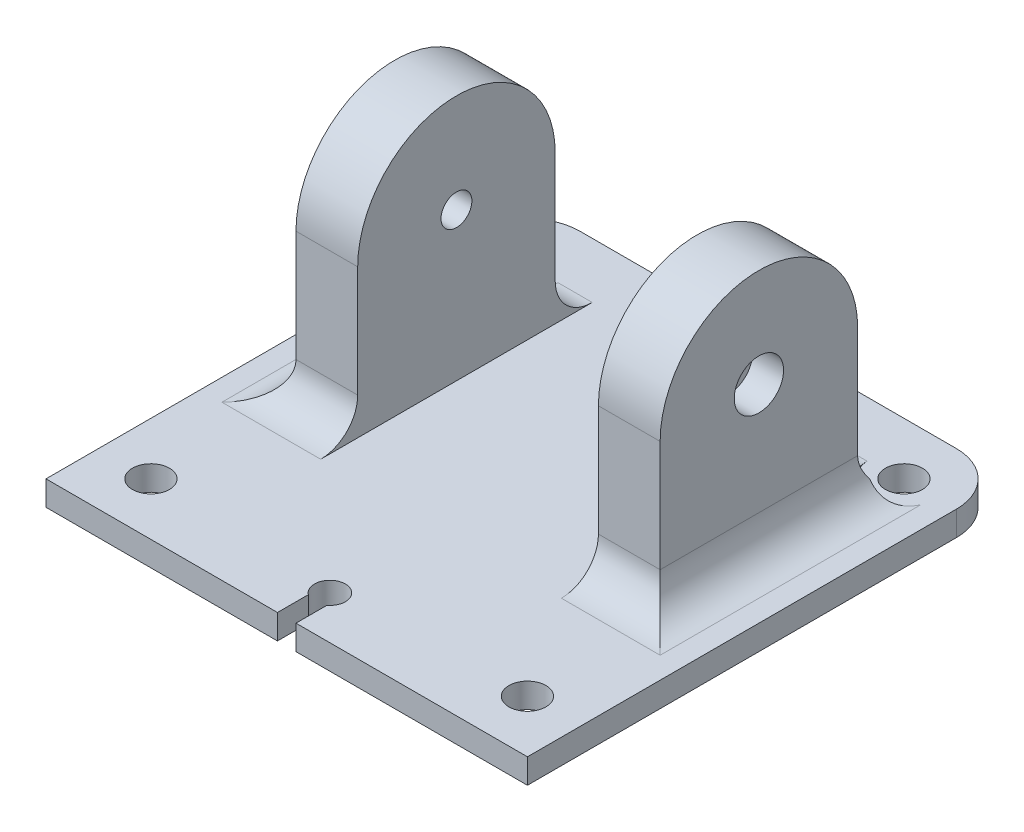
from build123d import *

# Parameters (mm, degrees)
SKETCH1_W           = 39
SKETCH1_H           = 39
SKETCH1_R           = 1.5
BOSS_EXTRUDE1_DEPTH = 2
SKETCH2_W           = 5
SKETCH2_H           = 16
BOSS_EXTRUDE2_DEPTH = 20
CUT_EXTRUDE1_REACH  = 47.137
SKETCH3_R           = 1.25
CUT_EXTRUDE2_REACH  = 36.066
SKETCH4_R           = 1.25
SKETCH4_W           = 1.5
SKETCH4_H           = 3.5
FILLET1_R           = 3
SKETCH6_R           = 2
CUT_EXTRUDE3_DEPTH  = 2.5
CUT_EXTRUDE4_START  = -2.5
SKETCH7_R           = 2
CUT_EXTRUDE4_DEPTH  = 2.5
SKETCH8_R           = 2.75
CUT_EXTRUDE5_DEPTH  = 20


with BuildPart() as part:
    # Sketch1 → Boss-Extrude1 (new body)
    with BuildSketch(Plane(origin=(0, 0, 0), x_dir=(1, 0, 0), z_dir=(0, 1, 0))):
        Rectangle(SKETCH1_W, SKETCH1_H)
        with Locations(Location((-15.25, 15.25, 0), (0, 0, 270))):
            Circle(SKETCH1_R, mode=Mode.SUBTRACT)
        with Locations(Location((15.25, 15.25, 0), (0, 0, 90))):
            Circle(SKETCH1_R, mode=Mode.SUBTRACT)
        with Locations(Location((15.25, -15.25, 0), (0, 0, 270))):
            Circle(SKETCH1_R, mode=Mode.SUBTRACT)
        with Locations(Location((-15.25, -15.25, 0), (0, 0, 90))):
            Circle(SKETCH1_R, mode=Mode.SUBTRACT)
    extrude(amount=BOSS_EXTRUDE1_DEPTH)

    # Sketch2 → Boss-Extrude2 (add)
    with BuildSketch(Plane(origin=(0, 2, 0), x_dir=(1, 0, 0), z_dir=(0, 1, 0))):
        with Locations((-12.25, 4)):
            Rectangle(SKETCH2_W, SKETCH2_H)
        with Locations((12.25, 4)):
            Rectangle(SKETCH2_W, SKETCH2_H)
    extrude(amount=BOSS_EXTRUDE2_DEPTH)

    # Cut-Extrude1: up to this face of the body (flat: up to its plane)
    cut_extrude1_end = Plane(part.part.faces().sort_by_distance((14.75, 12, -4))[0])
    # Sketch3 → Cut-Extrude1 (cut, up to the picked face)
    with BuildSketch(Plane.ZY.offset(14.75), mode=Mode.PRIVATE) as cut_extrude1_sk1:
        with BuildLine():
            Line((-12, 22), (-12, 14))
            ThreePointArc((-12, 14), (-9.656854249, 19.656854249), (-4, 22))
            Line((-4, 22), (-12, 22))
        make_face()
    cut_extrude1_tool1 = split(extrude(cut_extrude1_sk1.sketch, amount=-CUT_EXTRUDE1_REACH, mode=Mode.PRIVATE), bisect_by=cut_extrude1_end, keep=Keep.BOTH, mode=Mode.PRIVATE)
    # Sketch3 → Cut-Extrude1 (cut, up to the picked face)
    with BuildSketch(Plane.ZY.offset(14.75), mode=Mode.PRIVATE) as cut_extrude1_sk2:
        with BuildLine():
            ThreePointArc((-4, 22), (1.656854249, 19.656854249), (4, 14))
            Line((4, 14), (4, 22))
            Line((4, 22), (-4, 22))
        make_face()
    cut_extrude1_tool2 = split(extrude(cut_extrude1_sk2.sketch, amount=-CUT_EXTRUDE1_REACH, mode=Mode.PRIVATE), bisect_by=cut_extrude1_end, keep=Keep.BOTH, mode=Mode.PRIVATE)
    # Sketch3 → Cut-Extrude1 (cut, up to the picked face)
    with BuildSketch(Plane.ZY.offset(14.75), mode=Mode.PRIVATE) as cut_extrude1_sk3:
        with Locations(Location((-4, 14, 0), (0, 0, 180))):
            Circle(SKETCH3_R)
    cut_extrude1_tool3 = split(extrude(cut_extrude1_sk3.sketch, amount=-CUT_EXTRUDE1_REACH, mode=Mode.PRIVATE), bisect_by=cut_extrude1_end, keep=Keep.BOTH, mode=Mode.PRIVATE)
    add(cut_extrude1_tool1.solids().sort_by(Axis((-14.75, 20.213056, -10.213056), (1, 0, 0)))[0], mode=Mode.SUBTRACT)
    add(cut_extrude1_tool2.solids().sort_by(Axis((-14.75, 20.213056, 2.213056), (1, 0, 0)))[0], mode=Mode.SUBTRACT)
    add(cut_extrude1_tool3.solids().sort_by(Axis((-14.75, 14, -4), (1, 0, 0)))[0], mode=Mode.SUBTRACT)

    # Sketch4 → Cut-Extrude2 (cut, up to next)
    with BuildSketch(Plane(origin=(0, 2, 0), x_dir=(1, 0, 0), z_dir=(0, 1, 0)), mode=Mode.PRIVATE) as cut_extrude2_sk1:
        with BuildLine():
            Line((-19.5, 19.5), (-19.5, 15.25))
            ThreePointArc((-19.5, 15.25), (-18.25520382, 18.25520382), (-15.249999999, 19.5))
            Line((-15.249999999, 19.5), (-19.5, 19.5))
        make_face()
    cut_extrude2_tool1 = extrude(cut_extrude2_sk1.sketch, amount=-CUT_EXTRUDE2_REACH, mode=Mode.PRIVATE) & part.part
    # Sketch4 → Cut-Extrude2 (cut, up to next)
    with BuildSketch(Plane(origin=(0, 2, 0), x_dir=(1, 0, 0), z_dir=(0, 1, 0)), mode=Mode.PRIVATE) as cut_extrude2_sk2:
        with BuildLine():
            ThreePointArc((15.25, 19.5), (18.25520382, 18.25520382), (19.5, 15.25))
            Line((19.5, 15.25), (19.5, 19.5))
            Line((19.5, 19.5), (15.25, 19.5))
        make_face()
    cut_extrude2_tool2 = extrude(cut_extrude2_sk2.sketch, amount=-CUT_EXTRUDE2_REACH, mode=Mode.PRIVATE) & part.part
    # Sketch4 → Cut-Extrude2 (cut, up to next)
    with BuildSketch(Plane(origin=(0, 2, 0), x_dir=(1, 0, 0), z_dir=(0, 1, 0)), mode=Mode.PRIVATE) as cut_extrude2_sk3:
        with Locations((0, -16)):
            Circle(SKETCH4_R)
    cut_extrude2_tool3 = extrude(cut_extrude2_sk3.sketch, amount=-CUT_EXTRUDE2_REACH, mode=Mode.PRIVATE) & part.part
    # Sketch4 → Cut-Extrude2 (cut, up to next)
    with BuildSketch(Plane(origin=(0, 2, 0), x_dir=(1, 0, 0), z_dir=(0, 1, 0)), mode=Mode.PRIVATE) as cut_extrude2_sk4:
        with Locations((0, -17.75)):
            Rectangle(SKETCH4_W, SKETCH4_H)
    cut_extrude2_tool4 = extrude(cut_extrude2_sk4.sketch, amount=-CUT_EXTRUDE2_REACH, mode=Mode.PRIVATE) & part.part
    add(cut_extrude2_tool1.solids().sort_by_distance((-18.550686, 2, -18.550686))[0], mode=Mode.SUBTRACT)
    add(cut_extrude2_tool2.solids().sort_by_distance((18.550686, 2, -18.550686))[0], mode=Mode.SUBTRACT)
    add(cut_extrude2_tool3.solids().sort_by_distance((0, 2, 16))[0], mode=Mode.SUBTRACT)
    add(cut_extrude2_tool4.solids().sort_by_distance((0, 2, 17.75))[0], mode=Mode.SUBTRACT)

    # Fillet1
    # the kernel refuses this fillet: 3 mm, written as the material it adds along each edge
    with BuildSketch(Plane(origin=(-9.75, 2, -12), x_dir=(0, 0, -1), z_dir=(-1, 0, 0))) as fillet1_piece_1_section:
        with BuildLine():
            CenterArc((FILLET1_R, -FILLET1_R), FILLET1_R, 90, 90)
            Line((0, -FILLET1_R), (0, 0))
            Line((0, 0), (FILLET1_R, 0))
        make_face()
    fillet1_piece_1 = extrude(amount=5, mode=Mode.PRIVATE)
    fillet1_piece_1 = fillet1_piece_1 - Plane(origin=(-15.25, 2.68425546, -15.25), x_dir=(0, 0, 1), z_dir=(0, -1, 0)) * Cylinder(1.5, 23, mode=Mode.PRIVATE)
    add(fillet1_piece_1)
    with BuildSketch(Plane(origin=(-14.75, 2, -12), x_dir=(-1, 0, 0), z_dir=(0, 0, 1))) as fillet1_piece_2:
        with BuildLine():
            CenterArc((FILLET1_R, -FILLET1_R), FILLET1_R, 90, 90)
            Line((0, -FILLET1_R), (0, 0))
            Line((0, 0), (FILLET1_R, 0))
        make_face()
    extrude(amount=16)
    with BuildSketch(Plane(origin=(-14.75, 2, 4), x_dir=(0, 0, 1), z_dir=(1, 0, 0))) as fillet1_piece_3:
        with BuildLine():
            CenterArc((FILLET1_R, -FILLET1_R), FILLET1_R, 90, 90)
            Line((0, -FILLET1_R), (0, 0))
            Line((0, 0), (FILLET1_R, 0))
        make_face()
    extrude(amount=5)
    with BuildSketch(Plane(origin=(14.75, 2, 4), x_dir=(0, 0, 1), z_dir=(-1, 0, 0))) as fillet1_piece_4:
        with BuildLine():
            CenterArc((FILLET1_R, FILLET1_R), FILLET1_R, 180, 90)
            Line((0, FILLET1_R), (0, 0))
            Line((0, 0), (FILLET1_R, 0))
        make_face()
    extrude(amount=5)
    with BuildSketch(Plane(origin=(14.75, 2, -12), x_dir=(1, 0, 0), z_dir=(0, 0, 1))) as fillet1_piece_5:
        with BuildLine():
            CenterArc((FILLET1_R, FILLET1_R), FILLET1_R, 180, 90)
            Line((0, FILLET1_R), (0, 0))
            Line((0, 0), (FILLET1_R, 0))
        make_face()
    extrude(amount=16)
    with BuildSketch(Plane(origin=(9.75, 2, -12), x_dir=(0, 0, -1), z_dir=(1, 0, 0))) as fillet1_piece_6_section:
        with BuildLine():
            CenterArc((FILLET1_R, FILLET1_R), FILLET1_R, 180, 90)
            Line((0, FILLET1_R), (0, 0))
            Line((0, 0), (FILLET1_R, 0))
        make_face()
    fillet1_piece_6 = extrude(amount=5, mode=Mode.PRIVATE)
    fillet1_piece_6 = fillet1_piece_6 - Plane(origin=(15.25, 2.684255461, -15.25), x_dir=(0, 0, -1), z_dir=(0, -1, 0)) * Cylinder(1.5, 22, mode=Mode.PRIVATE)
    add(fillet1_piece_6)
    with BuildSketch(Plane(origin=(-9.75, 2, -12), x_dir=(0, 0, -1), z_dir=(-1, 0, 0))) as fillet1_piece_7a_section:
        with BuildLine():
            CenterArc((FILLET1_R, -FILLET1_R), FILLET1_R, 90, 90)
            Line((0, -FILLET1_R), (0, 0))
            Line((0, 0), (FILLET1_R, 0))
        make_face()
    fillet1_piece_7a = extrude(amount=12.5, mode=Mode.PRIVATE)
    fillet1_piece_7a = split(fillet1_piece_7a, bisect_by=Plane(origin=(-19.5, 2.695389127, -12.63970839), z_dir=(1, 0, 0)), keep=Keep.TOP, mode=Mode.PRIVATE)
    fillet1_piece_7a = fillet1_piece_7a - Plane(origin=(-15.25, 2.695389127, -15.25), x_dir=(0, 0, 1), z_dir=(0, -1, 0)) * Cylinder(1.5, 37, mode=Mode.PRIVATE)
    fillet1_piece_7a = split(fillet1_piece_7a, bisect_by=Plane(origin=(-14.75, 2.695389127, -12.63970839), z_dir=(-1, 0, 0)), keep=Keep.TOP, mode=Mode.PRIVATE)
    with BuildSketch(Plane(origin=(-14.75, 2, -19.5), x_dir=(-1, 0, 0), z_dir=(0, 0, 1))) as fillet1_piece_7b_section:
        with BuildLine():
            CenterArc((FILLET1_R, -FILLET1_R), FILLET1_R, 90, 90)
            Line((0, -FILLET1_R), (0, 0))
            Line((0, 0), (FILLET1_R, 0))
        make_face()
    fillet1_piece_7b = extrude(amount=23.5, mode=Mode.PRIVATE)
    fillet1_piece_7b = fillet1_piece_7b & Plane(origin=(-15.25, 2.080720084, -15.25), x_dir=(-1, 0, 0), z_dir=(0, 1, 0)) * Cylinder(4.25, 59, mode=Mode.PRIVATE)
    fillet1_piece_7b = fillet1_piece_7b - Plane(origin=(-15.25, 2.080720084, -15.25), x_dir=(0, 0, 1), z_dir=(0, -1, 0)) * Cylinder(1.5, 59, mode=Mode.PRIVATE)
    fillet1_piece_7b = split(fillet1_piece_7b, bisect_by=Plane(origin=(-16.967781304, 2.080720084, -12), z_dir=(0, 0, -1)), keep=Keep.TOP, mode=Mode.PRIVATE)
    fillet1_piece_7 = fillet1_piece_7a & fillet1_piece_7b
    add(fillet1_piece_7)
    with BuildSketch(Plane(origin=(-22.25, 2, 4), x_dir=(0, 0, 1), z_dir=(1, 0, 0))) as fillet1_piece_8a_section:
        with BuildLine():
            CenterArc((FILLET1_R, -FILLET1_R), FILLET1_R, 90, 90)
            Line((0, -FILLET1_R), (0, 0))
            Line((0, 0), (FILLET1_R, 0))
        make_face()
    fillet1_piece_8a = extrude(amount=12.5, mode=Mode.PRIVATE)
    fillet1_piece_8a = split(fillet1_piece_8a, bisect_by=Plane(origin=(-19.5, 2.679185343, 4.679185343), z_dir=(1, 0, 0)), keep=Keep.TOP, mode=Mode.PRIVATE)
    fillet1_piece_8a = split(fillet1_piece_8a, bisect_by=Plane(origin=(-14.75, 2.679185343, 4.679185343), z_dir=(-1, 0, 0)), keep=Keep.TOP, mode=Mode.PRIVATE)
    with BuildSketch(Plane(origin=(-14.75, 2, -12), x_dir=(-1, 0, 0), z_dir=(0, 0, 1))) as fillet1_piece_8b_section:
        with BuildLine():
            CenterArc((FILLET1_R, -FILLET1_R), FILLET1_R, 90, 90)
            Line((0, -FILLET1_R), (0, 0))
            Line((0, 0), (FILLET1_R, 0))
        make_face()
    fillet1_piece_8b = extrude(amount=23.5, mode=Mode.PRIVATE)
    fillet1_piece_8b = split(fillet1_piece_8b, bisect_by=Plane(origin=(-15.429185343, 2.679185343, 4), z_dir=(0, 0, 1)), keep=Keep.TOP, mode=Mode.PRIVATE)
    fillet1_piece_8 = fillet1_piece_8a & fillet1_piece_8b
    add(fillet1_piece_8)
    with BuildSketch(Plane(origin=(14.75, 2, -12), x_dir=(1, 0, 0), z_dir=(0, 0, 1))) as fillet1_piece_9a_section:
        with BuildLine():
            CenterArc((FILLET1_R, FILLET1_R), FILLET1_R, 180, 90)
            Line((0, FILLET1_R), (0, 0))
            Line((0, 0), (FILLET1_R, 0))
        make_face()
    fillet1_piece_9a = extrude(amount=23.5, mode=Mode.PRIVATE)
    fillet1_piece_9a = split(fillet1_piece_9a, bisect_by=Plane(origin=(15.429185343, 2.679185343, 4), z_dir=(0, 0, 1)), keep=Keep.TOP, mode=Mode.PRIVATE)
    with BuildSketch(Plane(origin=(22.25, 2, 4), x_dir=(0, 0, 1), z_dir=(-1, 0, 0))) as fillet1_piece_9b_section:
        with BuildLine():
            CenterArc((FILLET1_R, FILLET1_R), FILLET1_R, 180, 90)
            Line((0, FILLET1_R), (0, 0))
            Line((0, 0), (FILLET1_R, 0))
        make_face()
    fillet1_piece_9b = extrude(amount=12.5, mode=Mode.PRIVATE)
    fillet1_piece_9b = split(fillet1_piece_9b, bisect_by=Plane(origin=(19.5, 2.679185343, 4.679185343), z_dir=(-1, 0, 0)), keep=Keep.TOP, mode=Mode.PRIVATE)
    fillet1_piece_9b = split(fillet1_piece_9b, bisect_by=Plane(origin=(14.75, 2.679185343, 4.679185343), z_dir=(1, 0, 0)), keep=Keep.TOP, mode=Mode.PRIVATE)
    fillet1_piece_9 = fillet1_piece_9a & fillet1_piece_9b
    add(fillet1_piece_9)
    with BuildSketch(Plane(origin=(14.75, 2, -19.5), x_dir=(1, 0, 0), z_dir=(0, 0, 1))) as fillet1_piece_10a_section:
        with BuildLine():
            CenterArc((FILLET1_R, FILLET1_R), FILLET1_R, 180, 90)
            Line((0, FILLET1_R), (0, 0))
            Line((0, 0), (FILLET1_R, 0))
        make_face()
    fillet1_piece_10a = extrude(amount=23.5, mode=Mode.PRIVATE)
    fillet1_piece_10a = fillet1_piece_10a & Plane(origin=(15.25, 2.080720084, -15.25), x_dir=(0, 0, -1), z_dir=(0, 1, 0)) * Cylinder(4.25, 59, mode=Mode.PRIVATE)
    fillet1_piece_10a = fillet1_piece_10a - Plane(origin=(15.25, 2.080720084, -15.25), x_dir=(0, 0, -1), z_dir=(0, -1, 0)) * Cylinder(1.5, 59, mode=Mode.PRIVATE)
    fillet1_piece_10a = split(fillet1_piece_10a, bisect_by=Plane(origin=(16.967781304, 2.080720084, -12), z_dir=(0, 0, -1)), keep=Keep.TOP, mode=Mode.PRIVATE)
    with BuildSketch(Plane(origin=(9.75, 2, -12), x_dir=(0, 0, -1), z_dir=(1, 0, 0))) as fillet1_piece_10b_section:
        with BuildLine():
            CenterArc((FILLET1_R, FILLET1_R), FILLET1_R, 180, 90)
            Line((0, FILLET1_R), (0, 0))
            Line((0, 0), (FILLET1_R, 0))
        make_face()
    fillet1_piece_10b = extrude(amount=12.5, mode=Mode.PRIVATE)
    fillet1_piece_10b = split(fillet1_piece_10b, bisect_by=Plane(origin=(19.5, 2.695389122, -12.639708406), z_dir=(-1, 0, 0)), keep=Keep.TOP, mode=Mode.PRIVATE)
    fillet1_piece_10b = fillet1_piece_10b - Plane(origin=(15.25, 2.695389122, -15.25), x_dir=(0, 0, -1), z_dir=(0, -1, 0)) * Cylinder(1.5, 37, mode=Mode.PRIVATE)
    fillet1_piece_10b = split(fillet1_piece_10b, bisect_by=Plane(origin=(14.75, 2.695389122, -12.639708406), z_dir=(1, 0, 0)), keep=Keep.TOP, mode=Mode.PRIVATE)
    fillet1_piece_10 = fillet1_piece_10a & fillet1_piece_10b
    add(fillet1_piece_10)

    # Sketch6 → Cut-Extrude3 (cut)
    with BuildSketch(Plane.ZY.offset(14.75)):
        with Locations((-4, 14)):
            Circle(SKETCH6_R)
    extrude(amount=-CUT_EXTRUDE3_DEPTH, mode=Mode.SUBTRACT)

    # Sketch7 → Cut-Extrude4 (cut)
    with BuildSketch(Plane(origin=(14.75, 0, 0), x_dir=(0, 0, -1), z_dir=(1, 0, 0)).offset(CUT_EXTRUDE4_START)):
        with Locations(Location((4, 14, 0), (0, 0, 180))):
            Circle(SKETCH7_R)
    extrude(amount=CUT_EXTRUDE4_DEPTH, mode=Mode.SUBTRACT)

    # Sketch8 → Cut-Extrude5 (cut)
    with BuildSketch(Plane(origin=(0, 22, 0), x_dir=(1, 0, 0), z_dir=(0, 1, 0))):
        with Locations((-15.25, 15.25)):
            Circle(SKETCH8_R)
        with Locations((15.25, 15.25)):
            Circle(SKETCH8_R)
    extrude(amount=-CUT_EXTRUDE5_DEPTH, mode=Mode.SUBTRACT)


solid = part.part
